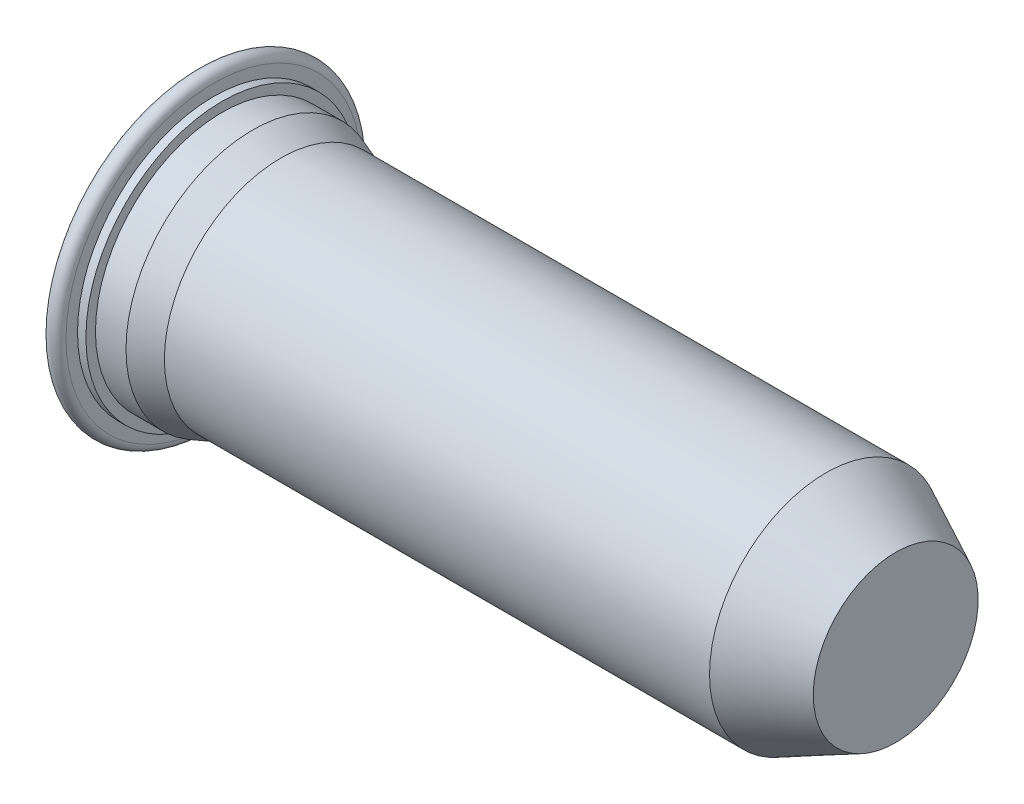
from build123d import *


with BuildPart() as part:
    # BodySke → BaseBody (revolve)
    with BuildSketch(Plane.XY):
        with BuildLine():
            Line((0, 0), (0, 4.02336))
            Line((0, 4.02336), (0.00508, 4.02336))
            Line((0.00508, 4.02336), (0.00508, 4.02844))
            ThreePointArc((0.00508, 4.02844), (0.23114, 4.2545), (0.4572, 4.02844))
            Line((0.4572, 4.02844), (0.4572, 3.71475))
            Line((0.4572, 3.71475), (0.6858, 3.71475))
            Line((0.6858, 3.71475), (0.6858, 3.4544))
            Line((0.6858, 3.4544), (1.518354809, 3.4544))
            Line((1.518354809, 3.4544), (2.286, 3.175))
            Line((2.286, 3.175), (17.149163308, 3.175))
            Line((17.149163308, 3.175), (19.05, 2.2479))
            Line((19.05, 2.2479), (19.05, 0))
            Line((19.05, 0), (0, 0))
        make_face()
    revolve(axis=Axis((0, 0, 0), (1, 0, 0)))


solid = part.part
